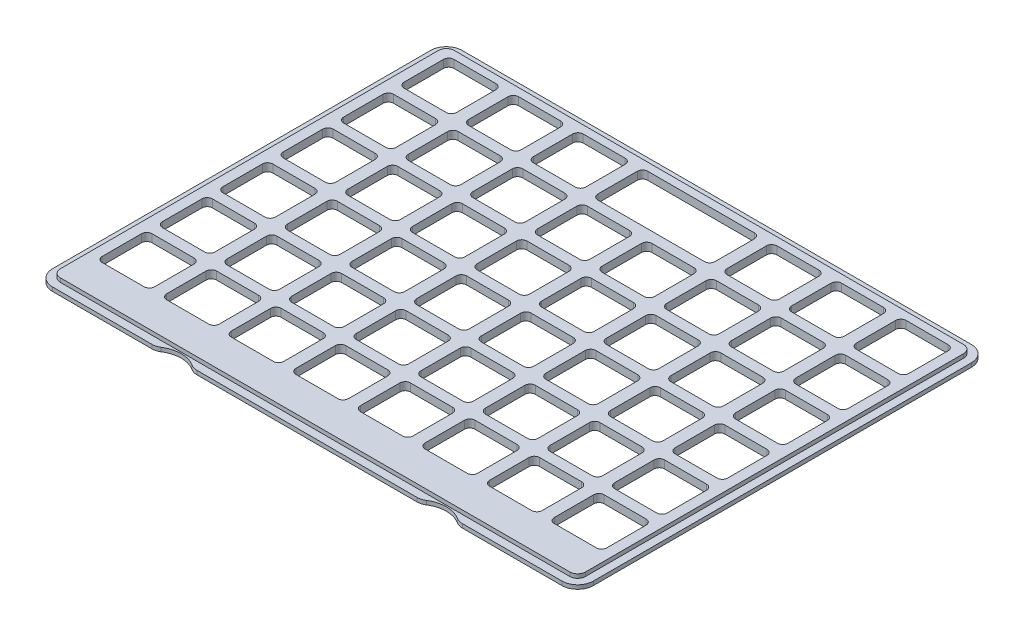
from build123d import *

# Parameters (mm, degrees)
SKETCH1_W                 = 206
SKETCH1_H                 = 156
OUTER_PROFILE_DEPTH       = 1.5
SKETCH2_W                 = 200
SKETCH2_H                 = 150
INNER_PROFILE_DEPTH       = 1.5
FILLET1_R                 = 3
FILLET2_R                 = 6
SKETCH5_W                 = 20
SKETCH5_H                 = 19
CUTOUT_DEPTH              = 130.236217834
CORNER_RAD_R              = 2
LPATTERN1_COUNT           = 8
LPATTERN1_PITCH           = 24.6
LPATTERN1_COUNT_DIR2      = 6
LPATTERN1_PITCH_DIR2      = 23
CORNER_RAD_OF_LPATTERN1_R = 2
SKETCH6_W                 = 8.6
SKETCH6_H                 = 19
CUT_EXTRUDE1_DEPTH        = 130.236217834
BASE_RIDGE_DEPTH          = 130.236217834
CORNER_R                  = 5
CORNER_OF_BASE_RIDGES_R   = 5


with BuildPart() as part:
    # Sketch1 → Outer Profile (new body)
    with BuildSketch(Plane(origin=(0, 0, 0), x_dir=(1, 0, 0), z_dir=(0, 1, 0))):
        Rectangle(SKETCH1_W, SKETCH1_H)
    extrude(amount=OUTER_PROFILE_DEPTH)

    # Sketch2 → Inner Profile (add)
    with BuildSketch(Plane(origin=(0, 1.5, 0), x_dir=(1, 0, 0), z_dir=(0, 1, 0))):
        Rectangle(SKETCH2_W, SKETCH2_H)
    extrude(amount=INNER_PROFILE_DEPTH)

    # Fillet1
    fillet1_edges = [part.edges().sort_by_distance(p)[0] for p in [
        (100, 2.25, 75),
        (100, 2.25, -75),
        (-100, 2.25, -75),
        (-100, 2.25, 75),
    ]]
    fillet(fillet1_edges, radius=FILLET1_R)

    # Fillet2
    fillet2_edges = [part.edges().sort_by_distance(p)[0] for p in [
        (-103, 0.75, -78),
        (103, 0.75, -78),
        (103, 0.75, 78),
        (-103, 0.75, 78),
    ]]
    fillet(fillet2_edges, radius=FILLET2_R)

    # Sketch5 → Cutout (cut, through all)
    with BuildSketch(Plane(origin=(0, 3, 0), x_dir=(1, 0, 0), z_dir=(0, 1, 0))):
        with Locations((-86.1, -52.5)):
            Rectangle(SKETCH5_W, SKETCH5_H)
    cutout = extrude(amount=-CUTOUT_DEPTH, mode=Mode.SUBTRACT)

    # Corner Rad
    corner_rad_edges = [part.edges().sort_by_distance(p)[0] for p in [
        (-76.1, 1.5, 62),
        (-76.1, 1.5, 43),
        (-96.1, 1.5, 43),
        (-96.1, 1.5, 62),
    ]]
    fillet(corner_rad_edges, radius=CORNER_RAD_R)

    # LPattern1: Cutout 8 × 6
    with Locations(*[(i * LPATTERN1_PITCH, 0, -j * LPATTERN1_PITCH_DIR2) for i in range(LPATTERN1_COUNT) for j in range(LPATTERN1_COUNT_DIR2) if (i, j) != (0, 0)]):
        add(cutout, mode=Mode.SUBTRACT)

    # Corner Rad of LPattern1
    corner_rad_of_lpattern1_edges = [part.edges().sort_by_distance(p)[0] for p in [
        (-76.1, 1.5, 39),
        (-76.1, 1.5, 20),
        (-96.1, 1.5, 20),
        (-96.1, 1.5, 39),
        (-76.1, 1.5, 16),
        (-76.1, 1.5, -3),
        (-96.1, 1.5, -3),
        (-96.1, 1.5, 16),
        (-76.1, 1.5, -7),
        (-76.1, 1.5, -26),
        (-96.1, 1.5, -26),
        (-96.1, 1.5, -7),
        (-76.1, 1.5, -30),
        (-76.1, 1.5, -49),
        (-96.1, 1.5, -49),
        (-96.1, 1.5, -30),
        (-76.1, 1.5, -53),
        (-76.1, 1.5, -72),
        (-96.1, 1.5, -72),
        (-96.1, 1.5, -53),
        (-51.5, 1.5, 62),
        (-51.5, 1.5, 43),
        (-71.5, 1.5, 43),
        (-71.5, 1.5, 62),
        (-51.5, 1.5, 39),
        (-51.5, 1.5, 20),
        (-71.5, 1.5, 20),
        (-71.5, 1.5, 39),
        (-51.5, 1.5, 16),
        (-51.5, 1.5, -3),
        (-71.5, 1.5, -3),
        (-71.5, 1.5, 16),
        (-51.5, 1.5, -7),
        (-51.5, 1.5, -26),
        (-71.5, 1.5, -26),
        (-71.5, 1.5, -7),
        (-51.5, 1.5, -30),
        (-51.5, 1.5, -49),
        (-71.5, 1.5, -49),
        (-71.5, 1.5, -30),
        (-51.5, 1.5, -53),
        (-51.5, 1.5, -72),
        (-71.5, 1.5, -72),
        (-71.5, 1.5, -53),
        (-26.9, 1.5, 62),
        (-26.9, 1.5, 43),
        (-46.9, 1.5, 43),
        (-46.9, 1.5, 62),
        (-26.9, 1.5, 39),
        (-26.9, 1.5, 20),
        (-46.9, 1.5, 20),
        (-46.9, 1.5, 39),
        (-26.9, 1.5, 16),
        (-26.9, 1.5, -3),
        (-46.9, 1.5, -3),
        (-46.9, 1.5, 16),
        (-26.9, 1.5, -7),
        (-26.9, 1.5, -26),
        (-46.9, 1.5, -26),
        (-46.9, 1.5, -7),
        (-26.9, 1.5, -30),
        (-26.9, 1.5, -49),
        (-46.9, 1.5, -49),
        (-46.9, 1.5, -30),
        (-26.9, 1.5, -53),
        (-26.9, 1.5, -72),
        (-46.9, 1.5, -72),
        (-46.9, 1.5, -53),
        (-2.3, 1.5, 62),
        (-2.3, 1.5, 43),
        (-22.3, 1.5, 43),
        (-22.3, 1.5, 62),
        (-2.3, 1.5, 39),
        (-2.3, 1.5, 20),
        (-22.3, 1.5, 20),
        (-22.3, 1.5, 39),
        (-2.3, 1.5, 16),
        (-2.3, 1.5, -3),
        (-22.3, 1.5, -3),
        (-22.3, 1.5, 16),
        (-2.3, 1.5, -7),
        (-2.3, 1.5, -26),
        (-22.3, 1.5, -26),
        (-22.3, 1.5, -7),
        (-2.3, 1.5, -30),
        (-2.3, 1.5, -49),
        (-22.3, 1.5, -49),
        (-22.3, 1.5, -30),
        (-2.3, 1.5, -53),
        (-2.3, 1.5, -72),
        (-22.3, 1.5, -72),
        (-22.3, 1.5, -53),
        (22.3, 1.5, 62),
        (22.3, 1.5, 43),
        (2.3, 1.5, 43),
        (2.3, 1.5, 62),
        (22.3, 1.5, 39),
        (22.3, 1.5, 20),
        (2.3, 1.5, 20),
        (2.3, 1.5, 39),
        (22.3, 1.5, 16),
        (22.3, 1.5, -3),
        (2.3, 1.5, -3),
        (2.3, 1.5, 16),
        (22.3, 1.5, -7),
        (22.3, 1.5, -26),
        (2.3, 1.5, -26),
        (2.3, 1.5, -7),
        (22.3, 1.5, -30),
        (22.3, 1.5, -49),
        (2.3, 1.5, -49),
        (2.3, 1.5, -30),
        (22.3, 1.5, -53),
        (22.3, 1.5, -72),
        (2.3, 1.5, -72),
        (2.3, 1.5, -53),
        (46.9, 1.5, 62),
        (46.9, 1.5, 43),
        (26.9, 1.5, 43),
        (26.9, 1.5, 62),
        (46.9, 1.5, 39),
        (46.9, 1.5, 20),
        (26.9, 1.5, 20),
        (26.9, 1.5, 39),
        (46.9, 1.5, 16),
        (46.9, 1.5, -3),
        (26.9, 1.5, -3),
        (26.9, 1.5, 16),
        (46.9, 1.5, -7),
        (46.9, 1.5, -26),
        (26.9, 1.5, -26),
        (26.9, 1.5, -7),
        (46.9, 1.5, -30),
        (46.9, 1.5, -49),
        (26.9, 1.5, -49),
        (26.9, 1.5, -30),
        (46.9, 1.5, -53),
        (46.9, 1.5, -72),
        (26.9, 1.5, -72),
        (26.9, 1.5, -53),
        (71.5, 1.5, 62),
        (71.5, 1.5, 43),
        (51.5, 1.5, 43),
        (51.5, 1.5, 62),
        (71.5, 1.5, 39),
        (71.5, 1.5, 20),
        (51.5, 1.5, 20),
        (51.5, 1.5, 39),
        (71.5, 1.5, 16),
        (71.5, 1.5, -3),
        (51.5, 1.5, -3),
        (51.5, 1.5, 16),
        (71.5, 1.5, -7),
        (71.5, 1.5, -26),
        (51.5, 1.5, -26),
        (51.5, 1.5, -7),
        (71.5, 1.5, -30),
        (71.5, 1.5, -49),
        (51.5, 1.5, -49),
        (51.5, 1.5, -30),
        (71.5, 1.5, -53),
        (71.5, 1.5, -72),
        (51.5, 1.5, -72),
        (51.5, 1.5, -53),
        (96.1, 1.5, 62),
        (96.1, 1.5, 43),
        (76.1, 1.5, 43),
        (76.1, 1.5, 62),
        (96.1, 1.5, 39),
        (96.1, 1.5, 20),
        (76.1, 1.5, 20),
        (76.1, 1.5, 39),
        (96.1, 1.5, 16),
        (96.1, 1.5, -3),
        (76.1, 1.5, -3),
        (76.1, 1.5, 16),
        (96.1, 1.5, -7),
        (96.1, 1.5, -26),
        (76.1, 1.5, -26),
        (76.1, 1.5, -7),
        (96.1, 1.5, -30),
        (96.1, 1.5, -49),
        (76.1, 1.5, -49),
        (76.1, 1.5, -30),
        (96.1, 1.5, -53),
        (96.1, 1.5, -72),
        (76.1, 1.5, -72),
        (76.1, 1.5, -53),
    ]]
    fillet(corner_rad_of_lpattern1_edges, radius=CORNER_RAD_OF_LPATTERN1_R)

    # Sketch6 → Cut-Extrude1 (cut, through all)
    with BuildSketch(Plane(origin=(0, 3, 0), x_dir=(1, 0, 0), z_dir=(0, 1, 0))):
        with Locations((0, 62.5)):
            Rectangle(SKETCH6_W, SKETCH6_H)
    extrude(amount=-CUT_EXTRUDE1_DEPTH, mode=Mode.SUBTRACT)

    # Sketch7 → Base Ridge (cut, through all)
    with BuildSketch(Plane(origin=(0, 3, 0), x_dir=(1, 0, 0), z_dir=(0, 1, 0))):
        with BuildLine():
            Line((-57.5, -78), (-43.5, -78))
            ThreePointArc((-43.5, -78), (-50.5, -75.5), (-57.5, -78))
        make_face()
    base_ridge = extrude(amount=-BASE_RIDGE_DEPTH, mode=Mode.SUBTRACT)

    # Corner
    corner_edges = [part.edges().sort_by_distance(p)[0] for p in [
        (-43.5, 0.75, 78),
        (-57.5, 0.75, 78),
    ]]
    fillet(corner_edges, radius=CORNER_R)

    # Base Ridges: Base Ridge across plane
    add(base_ridge.mirror(Plane(origin=(0, 0, 0), x_dir=(0, 0, 1), z_dir=(1, 0, 0))), mode=Mode.SUBTRACT)

    # Corner of Base Ridges
    corner_of_base_ridges_edges = [part.edges().sort_by_distance(p)[0] for p in [
        (43.5, 0.75, 78),
        (57.5, 0.75, 78),
    ]]
    fillet(corner_of_base_ridges_edges, radius=CORNER_OF_BASE_RIDGES_R)


solid = part.part
